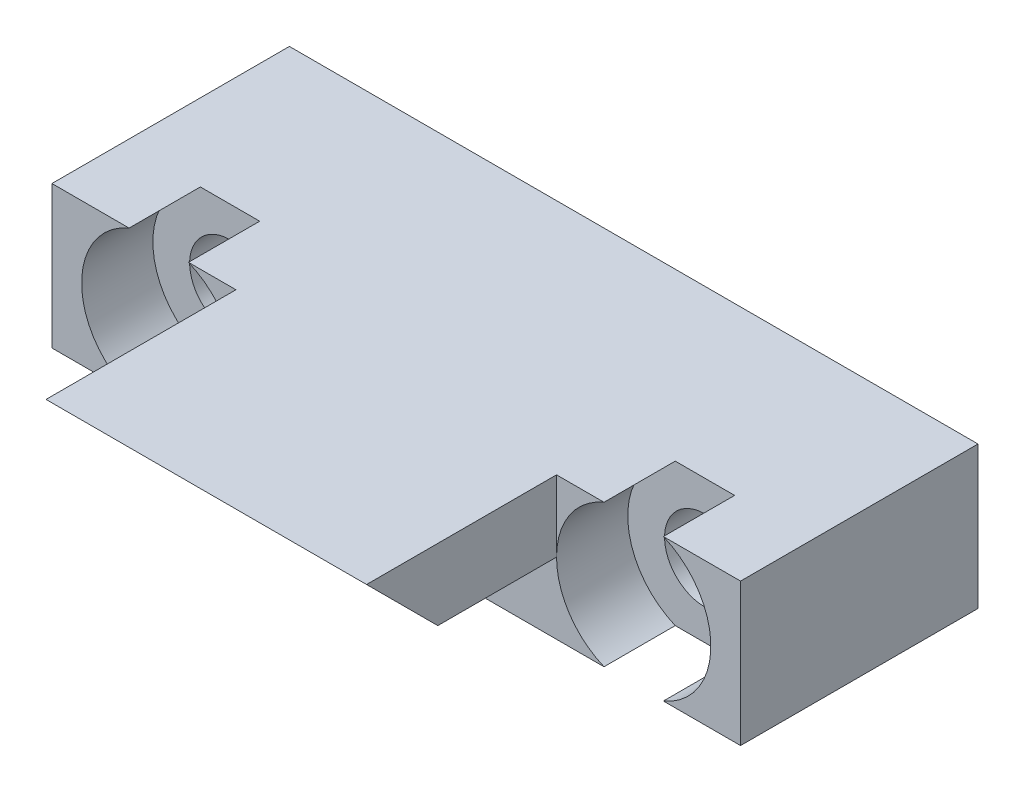
from build123d import *

# Parameters (mm, degrees)
SKETCH1_W                      = 29
SKETCH1_H                      = 6
BOSS_EXTRUDE1_DEPTH            = 10
SKETCH5_W                      = 13.5
SKETCH5_H                      = 3
BOSS_EXTRUDE2_DEPTH            = 8
CBORE_FOR_M3_SHCS1_D           = 3.4
CBORE_FOR_M3_SHCS1_CBORE_D     = 6.5
CBORE_FOR_M3_SHCS1_CBORE_DEPTH = 3
CHAMFER1_SIZE                  = 3


with BuildPart() as part:
    # Sketch1 → Boss-Extrude1 (new body)
    with BuildSketch(Plane.XY):
        Rectangle(SKETCH1_W, SKETCH1_H)
    extrude(amount=BOSS_EXTRUDE1_DEPTH)

    # Sketch5 → Boss-Extrude2 (add)
    with BuildSketch(Plane.XY.offset(10)):
        with Locations((0, 1.5)):
            Rectangle(SKETCH5_W, SKETCH5_H)
    extrude(amount=BOSS_EXTRUDE2_DEPTH)

    # CBORE for M3 SHCS1 (through all)
    with Locations(Plane.XY.offset(10)):
        with Locations((-10, 0), (10, 0)):
            CounterBoreHole(CBORE_FOR_M3_SHCS1_D / 2, CBORE_FOR_M3_SHCS1_CBORE_D / 2, CBORE_FOR_M3_SHCS1_CBORE_DEPTH)

    # Chamfer1
    chamfer1_edges = [part.edges().sort_by_distance(p)[0] for p in [
        (0, 0, 18),
    ]]
    chamfer(chamfer1_edges, length=CHAMFER1_SIZE - 0.0001)  # a hair under: the kernel refuses the full size


solid = part.part
